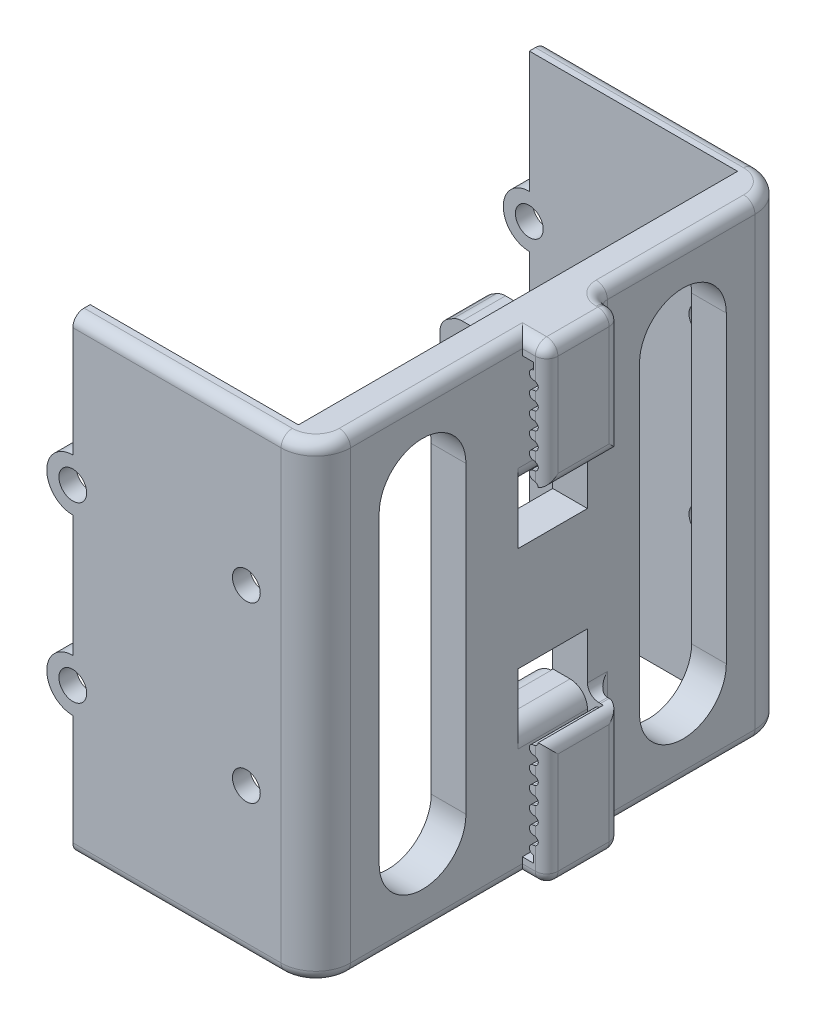
from build123d import *

# Parameters (mm, degrees)
SKETCH1_R                       = 1.6
BOSS_EXTRUDE1_DEPTH             = 2
SKETCH2_W                       = 54
SKETCH2_H                       = 54.6
SKETCH2_W_2                     = 6
SKETCH2_H_2                     = 8
BOSS_EXTRUDE2_DEPTH             = 4
BOSS_EXTRUDE6_DEPTH             = 2.5
BOSS_EXTRUDE6_DEPTH_BACK        = 2.5
BOSS_EXTRUDE7_REACH             = 45.279
BOSS_EXTRUDE7_DIRECTION_2_REACH = 45.279
FILLET3_R                       = 4
FILLET1_R                       = 2
FILLET2_R                       = 2
FILLET4_R                       = 2
BOSS_EXTRUDE8_START             = -4
BOSS_EXTRUDE8_DEPTH             = 7.5
SKETCH7_W                       = 2.8
SKETCH7_H                       = 14.3
BOSS_EXTRUDE9_DEPTH             = 1
FILLET5_R                       = 1.3
CUT_EXTRUDE1_DEPTH              = 4


with BuildPart() as part:
    # Sketch1 → Boss-Extrude1 (new body)
    with BuildSketch(Plane(origin=(0, 0, 25.3), x_dir=(0, 1, 0), z_dir=(0, 0, 1))):
        with BuildLine():
            Line((-13, 12), (-27, 12))
            Line((-27, 12), (-27, -12))
            Line((-27, -12), (27, -12))
            Line((27, -12), (27, 12))
            Line((27, 12), (13, 12))
            ThreePointArc((13, 12), (10, 15), (7, 12))
            Line((7, 12), (-7, 12))
            ThreePointArc((-7, 12), (-10, 15), (-13, 12))
        make_face()
        with Locations(Location((-10, 12, 0), (0, 0, 270))):
            Circle(SKETCH1_R, mode=Mode.SUBTRACT)
        with Locations(Location((10, 12, 0), (0, 0, 270))):
            Circle(SKETCH1_R, mode=Mode.SUBTRACT)
        with Locations(Location((10, -8, 0), (0, 0, 270))):
            Circle(SKETCH1_R, mode=Mode.SUBTRACT)
        with Locations(Location((-10, -8, 0), (0, 0, 270))):
            Circle(SKETCH1_R, mode=Mode.SUBTRACT)
    extrude(amount=BOSS_EXTRUDE1_DEPTH)


with BuildPart() as body_2:
    # Mirror3: mirrored copy
    add(part.part.mirror(Plane.XY))


with BuildPart() as part_1:
    add(part.part)

    add(body_2.part)  # Boss-Extrude2 merges body 2
    # Sketch2 → Boss-Extrude2 (add)
    with BuildSketch(Plane.YZ.offset(12)):
        Rectangle(SKETCH2_W, SKETCH2_H)
        with Locations((-9, 0)):
            Rectangle(SKETCH2_W_2, SKETCH2_H_2, mode=Mode.SUBTRACT)
        with Locations((9, 0)):
            Rectangle(SKETCH2_W_2, SKETCH2_H_2, mode=Mode.SUBTRACT)
    extrude(amount=BOSS_EXTRUDE2_DEPTH)

    # Sketch3 → Boss-Extrude6 (add, two sides: drawn at the far end of the back side and taken through both)
    with BuildSketch(Plane(origin=(0, 0, 0), x_dir=(0, 1, 0), z_dir=(0, 0, 1)).offset(-BOSS_EXTRUDE6_DEPTH_BACK)):
        Polygon((-24, -12), (-24, -7.5), (-22.8, -5.5), (-20, -5.5), (-12, -11), (-12, -12), align=None)
        Polygon((12, -12), (24, -12), (24, -7.5), (22.8, -5.5), (20, -5.5), (12, -11), align=None)
    extrude(amount=BOSS_EXTRUDE6_DEPTH + BOSS_EXTRUDE6_DEPTH_BACK)

    # Boss-Extrude7: up to this face of the body (flat: up to its plane)
    boss_extrude7_end = Plane(part_1.part.faces().sort_by_distance((14, -9, -4))[0])
    # Sketch5 → Boss-Extrude7 (add, up to the picked face)
    with BuildSketch(Plane(origin=(0, 0, -2.5), x_dir=(1, 0, 0), z_dir=(0, 0, -1)), mode=Mode.PRIVATE) as boss_extrude7_sk1:
        Polygon((12, 12), (11, 12), (10.3125, 13), (12, 13), align=None)
    boss_extrude7_tool1 = split(extrude(boss_extrude7_sk1.sketch, amount=BOSS_EXTRUDE7_REACH, mode=Mode.PRIVATE), bisect_by=boss_extrude7_end, keep=Keep.BOTH, mode=Mode.PRIVATE)
    # Sketch5 → Boss-Extrude7 (add, up to the picked face)
    with BuildSketch(Plane(origin=(0, 0, -2.5), x_dir=(1, 0, 0), z_dir=(0, 0, -1)), mode=Mode.PRIVATE) as boss_extrude7_sk2:
        Polygon((12, -13), (12, -12), (11, -12), (10.3125, -13), align=None)
    boss_extrude7_tool2 = split(extrude(boss_extrude7_sk2.sketch, amount=BOSS_EXTRUDE7_REACH, mode=Mode.PRIVATE), bisect_by=boss_extrude7_end, keep=Keep.BOTH, mode=Mode.PRIVATE)
    add(boss_extrude7_tool1.solids().sort_by(Axis((11.313469, -12.542636, -2.5), (0, 0, -1)))[0])
    add(boss_extrude7_tool2.solids().sort_by(Axis((11.313469, 12.542636, -2.5), (0, 0, -1)))[0])

    # Boss-Extrude7 direction 2: up to this face of the body (flat: up to its plane)
    boss_extrude7_direction_2_end = Plane(part_1.part.faces().sort_by_distance((14, -9, 4))[0])
    # Sketch5 → Boss-Extrude7 direction 2 (add, up to the picked face)
    with BuildSketch(Plane(origin=(0, 0, -2.5), x_dir=(1, 0, 0), z_dir=(0, 0, -1)), mode=Mode.PRIVATE) as boss_extrude7_direction_2_sk1:
        Polygon((12, 12), (11, 12), (10.3125, 13), (12, 13), align=None)
    boss_extrude7_direction_2_tool1 = split(extrude(boss_extrude7_direction_2_sk1.sketch, amount=-BOSS_EXTRUDE7_DIRECTION_2_REACH, mode=Mode.PRIVATE), bisect_by=boss_extrude7_direction_2_end, keep=Keep.BOTH, mode=Mode.PRIVATE)
    # Sketch5 → Boss-Extrude7 direction 2 (add, up to the picked face)
    with BuildSketch(Plane(origin=(0, 0, -2.5), x_dir=(1, 0, 0), z_dir=(0, 0, -1)), mode=Mode.PRIVATE) as boss_extrude7_direction_2_sk2:
        Polygon((12, -13), (12, -12), (11, -12), (10.3125, -13), align=None)
    boss_extrude7_direction_2_tool2 = split(extrude(boss_extrude7_direction_2_sk2.sketch, amount=-BOSS_EXTRUDE7_DIRECTION_2_REACH, mode=Mode.PRIVATE), bisect_by=boss_extrude7_direction_2_end, keep=Keep.BOTH, mode=Mode.PRIVATE)
    add(boss_extrude7_direction_2_tool1.solids().sort_by(Axis((11.313469, -12.542636, -2.5), (0, 0, 1)))[0])
    add(boss_extrude7_direction_2_tool2.solids().sort_by(Axis((11.313469, 12.542636, -2.5), (0, 0, 1)))[0])

    # Fillet3
    fillet3_edges = [part_1.edges().sort_by_distance(p)[0] for p in [
        (16, 0, -27.3),
        (16, 0, 27.3),
    ]]
    fillet(fillet3_edges, radius=FILLET3_R)

    # Fillet1
    fillet1_edges = [part_1.edges().sort_by_distance(p)[0] for p in [
        (7.5, -24, 0),
        (5.5, -22.8, 0),
        (5.5, -20, 0),
        (5.5, 20, 0),
        (5.5, 22.8, 0),
        (7.5, 24, 0),
    ]]
    fillet(fillet1_edges, radius=FILLET1_R)

    # Fillet2
    # the kernel refuses this fillet: 2 mm, written as the material it takes off along each edge
    with BuildSketch(Plane(origin=(11, -12, -4), x_dir=(1, 0, 0), z_dir=(0, 0, 1))) as fillet2_piece_1:
        with BuildLine():
            CenterArc((FILLET2_R * 0.526030489934, -FILLET2_R), FILLET2_R, 90, 55.491477012)
            Line((-FILLET2_R * 0.298011434265, -FILLET2_R * 0.433471177113), (0, 0))
            Line((0, 0), (FILLET2_R * 0.526030489934, 0))
        make_face()
    extrude(amount=8, mode=Mode.SUBTRACT)
    with BuildSketch(Plane(origin=(11, 12, 4), x_dir=(-0.5665288228870663, 0.8240419241993667, 0), z_dir=(0, 0, -1))) as fillet2_piece_2:
        with BuildLine():
            CenterArc((FILLET2_R * 0.526030489934, FILLET2_R), FILLET2_R, 214.508522988, 55.491477012)
            Line((-FILLET2_R * 0.298011434265, FILLET2_R * 0.433471177113), (0, 0))
            Line((0, 0), (FILLET2_R * 0.526030489934, 0))
        make_face()
    extrude(amount=8, mode=Mode.SUBTRACT)
    with BuildSketch(Plane(origin=(16, -12, -4), x_dir=(0, -1, 0), z_dir=(0, 0, 1))) as fillet2_piece_3:
        with BuildLine():
            CenterArc((FILLET2_R, -FILLET2_R), FILLET2_R, 90, 90)
            Line((0, -FILLET2_R), (0, 0))
            Line((0, 0), (FILLET2_R, 0))
        make_face()
    extrude(amount=8, mode=Mode.SUBTRACT)
    with BuildSketch(Plane(origin=(16, 12, 4), x_dir=(-1, 0, 0), z_dir=(0, 0, -1))) as fillet2_piece_4:
        with BuildLine():
            CenterArc((FILLET2_R, FILLET2_R), FILLET2_R, 180, 90)
            Line((0, FILLET2_R), (0, 0))
            Line((0, 0), (FILLET2_R, 0))
        make_face()
    extrude(amount=8, mode=Mode.SUBTRACT)

    # Fillet4
    # the kernel refuses this fillet: 2 mm, written as the material it takes off along each edge
    with BuildSketch(Plane(origin=(12, 13, 4), x_dir=(0, -1, 0), z_dir=(-1, 0, 0))) as fillet4_piece_1:
        with BuildLine():
            CenterArc((1.936491673, -2), FILLET4_R, 90, 75.522487814)
            Line((0, -1.5), (0, 0))
            Line((0, 0), (1.936491673, 0))
        make_face()
    extrude(amount=6.528729183, mode=Mode.SUBTRACT)
    with BuildSketch(Plane(origin=(12, 13, -4), x_dir=(0, 0, 1), z_dir=(-1, 0, 0))) as fillet4_piece_2:
        with BuildLine():
            CenterArc((2, -1.936491673), FILLET4_R, 104.477512186, 75.522487814)
            Line((0, -1.936491673), (0, 0))
            Line((0, 0), (1.5, 0))
        make_face()
    extrude(amount=6.528729183, mode=Mode.SUBTRACT)
    with BuildSketch(Plane(origin=(12, -13, -4), x_dir=(0, 0, 1), z_dir=(-1, 0, 0))) as fillet4_piece_3:
        with BuildLine():
            CenterArc((2, 1.936491673), FILLET4_R, 180, 75.522487814)
            Line((0, 1.936491673), (0, 0))
            Line((0, 0), (1.5, 0))
        make_face()
    extrude(amount=6.528729183, mode=Mode.SUBTRACT)
    with BuildSketch(Plane(origin=(12, -13, 4), x_dir=(0, 1, 0), z_dir=(-1, 0, 0))) as fillet4_piece_4:
        with BuildLine():
            CenterArc((1.936491673, 2), FILLET4_R, 194.477512186, 75.522487814)
            Line((0, 1.5), (0, 0))
            Line((0, 0), (1.936491673, 0))
        make_face()
    extrude(amount=6.528729183, mode=Mode.SUBTRACT)

    # Sketch6 → Boss-Extrude8 (add)
    with BuildSketch(Plane(origin=(0, 0, 0), x_dir=(0, 1, 0), z_dir=(0, 0, 1)).offset(BOSS_EXTRUDE8_START)):
        with BuildLine():
            Line((-25, -16), (-27, -16))
            Line((-27, -16), (-27, -18.8))
            Line((-27, -18.8), (-12.7, -18.8))
            Line((-12.7, -18.8), (-12.7, -17.8))
            ThreePointArc((-12.7, -17.8), (-13.053553391, -17.653553391), (-13.2, -17.3))
            ThreePointArc((-13.2, -17.3), (-13.7, -16.8), (-14.2, -17.3))
            ThreePointArc((-14.2, -17.3), (-14.7, -17.8), (-15.2, -17.3))
            ThreePointArc((-15.2, -17.3), (-15.7, -16.8), (-16.2, -17.3))
            ThreePointArc((-16.2, -17.3), (-16.7, -17.8), (-17.2, -17.3))
            ThreePointArc((-17.2, -17.3), (-17.7, -16.8), (-18.2, -17.3))
            ThreePointArc((-18.2, -17.3), (-18.7, -17.8), (-19.2, -17.3))
            ThreePointArc((-19.2, -17.3), (-19.7, -16.8), (-20.2, -17.3))
            ThreePointArc((-20.2, -17.3), (-20.7, -17.8), (-21.2, -17.3))
            ThreePointArc((-21.2, -17.3), (-21.7, -16.8), (-22.2, -17.3))
            ThreePointArc((-22.2, -17.3), (-22.7, -17.8), (-23.2, -17.3))
            ThreePointArc((-23.2, -17.3), (-23.7, -16.8), (-24.2, -17.3))
            Line((-24.2, -17.3), (-25, -17.3))
            Line((-25, -17.3), (-25, -16))
        make_face()
    boss_extrude8 = extrude(amount=BOSS_EXTRUDE8_DEPTH)

    # Sketch7 → Boss-Extrude9 (add)
    with BuildSketch(Plane(origin=(0, 0, -4), x_dir=(1, 0, 0), z_dir=(0, 0, -1))):
        with Locations((17.4, 19.85)):
            Rectangle(SKETCH7_W, SKETCH7_H)
    boss_extrude9 = extrude(amount=BOSS_EXTRUDE9_DEPTH)

    # Mirror4: Boss-Extrude8, Boss-Extrude9 across plane
    add(boss_extrude8.mirror(Plane.ZX))
    add(boss_extrude9.mirror(Plane.ZX))

    # Fillet5
    # the kernel refuses this fillet: 1.3 mm, written as the material it adds along each edge
    with BuildSketch(Plane(origin=(16, -12.7, -4), x_dir=(0, 1, 0), z_dir=(0, 0, -1))) as fillet5_piece_1:
        with BuildLine():
            CenterArc((FILLET5_R, FILLET5_R), FILLET5_R, 180, 90)
            Line((0, FILLET5_R), (0, 0))
            Line((0, 0), (FILLET5_R, 0))
        make_face()
    extrude(amount=1)
    with BuildSketch(Plane(origin=(16, -27, -5), x_dir=(0, 0, -1), z_dir=(0, 1, 0))) as fillet5_piece_2:
        with BuildLine():
            CenterArc((FILLET5_R, -FILLET5_R), FILLET5_R, 90, 90)
            Line((0, -FILLET5_R), (0, 0))
            Line((0, 0), (FILLET5_R, 0))
        make_face()
    extrude(amount=14.3)
    with BuildSketch(Plane(origin=(16, 27, -5), x_dir=(0, 0, -1), z_dir=(0, -1, 0))) as fillet5_piece_3:
        with BuildLine():
            CenterArc((FILLET5_R, FILLET5_R), FILLET5_R, 180, 90)
            Line((0, FILLET5_R), (0, 0))
            Line((0, 0), (FILLET5_R, 0))
        make_face()
    extrude(amount=14.3)
    with BuildSketch(Plane(origin=(16, 12.7, -4), x_dir=(0, -1, 0), z_dir=(0, 0, -1))) as fillet5_piece_4:
        with BuildLine():
            CenterArc((FILLET5_R, -FILLET5_R), FILLET5_R, 90, 90)
            Line((0, -FILLET5_R), (0, 0))
            Line((0, 0), (FILLET5_R, 0))
        make_face()
    extrude(amount=1)
    with BuildSketch(Plane(origin=(16, -12.7, -4), x_dir=(0, 1, 0), z_dir=(0, 0, -1))) as fillet5_piece_5a_section:
        with BuildLine():
            CenterArc((FILLET5_R, FILLET5_R), FILLET5_R, 180, 90)
            Line((0, FILLET5_R), (0, 0))
            Line((0, 0), (FILLET5_R, 0))
        make_face()
    fillet5_piece_5a = extrude(amount=4.25, mode=Mode.PRIVATE)
    fillet5_piece_5a = split(fillet5_piece_5a, bisect_by=Plane(origin=(16, -12.7, -5), z_dir=(0, 0, -1)), keep=Keep.TOP, mode=Mode.PRIVATE)
    with BuildSketch(Plane(origin=(16, -27, -5), x_dir=(0, 0, -1), z_dir=(0, 1, 0))) as fillet5_piece_5b_section:
        with BuildLine():
            CenterArc((FILLET5_R, -FILLET5_R), FILLET5_R, 90, 90)
            Line((0, -FILLET5_R), (0, 0))
            Line((0, 0), (FILLET5_R, 0))
        make_face()
    fillet5_piece_5b = extrude(amount=17.55, mode=Mode.PRIVATE)
    fillet5_piece_5b = split(fillet5_piece_5b, bisect_by=Plane(origin=(16, -12.7, -5), z_dir=(0, 1, 0)), keep=Keep.TOP, mode=Mode.PRIVATE)
    fillet5_piece_5 = fillet5_piece_5a & fillet5_piece_5b
    add(fillet5_piece_5)
    with BuildSketch(Plane(origin=(16, 27, -5), x_dir=(0, 0, -1), z_dir=(0, -1, 0))) as fillet5_piece_6a_section:
        with BuildLine():
            CenterArc((FILLET5_R, FILLET5_R), FILLET5_R, 180, 90)
            Line((0, FILLET5_R), (0, 0))
            Line((0, 0), (FILLET5_R, 0))
        make_face()
    fillet5_piece_6a = extrude(amount=17.55, mode=Mode.PRIVATE)
    fillet5_piece_6a = split(fillet5_piece_6a, bisect_by=Plane(origin=(16, 12.7, -5), z_dir=(0, -1, 0)), keep=Keep.TOP, mode=Mode.PRIVATE)
    with BuildSketch(Plane(origin=(16, 12.7, -4), x_dir=(0, -1, 0), z_dir=(0, 0, -1))) as fillet5_piece_6b_section:
        with BuildLine():
            CenterArc((FILLET5_R, -FILLET5_R), FILLET5_R, 90, 90)
            Line((0, -FILLET5_R), (0, 0))
            Line((0, 0), (FILLET5_R, 0))
        make_face()
    fillet5_piece_6b = extrude(amount=4.25, mode=Mode.PRIVATE)
    fillet5_piece_6b = split(fillet5_piece_6b, bisect_by=Plane(origin=(16, 12.7, -5), z_dir=(0, 0, -1)), keep=Keep.TOP, mode=Mode.PRIVATE)
    fillet5_piece_6 = fillet5_piece_6a & fillet5_piece_6b
    add(fillet5_piece_6)
    # the kernel refuses this fillet: 1.3 mm, written as the material it takes off along each edge
    with BuildSketch(Plane(origin=(17.5, -25.7, 2.2), x_dir=(0, 0, 1), z_dir=(0, -1, 0))) as fillet5_2_piece_1_section:
        Polygon((0, 0), (FILLET5_R, 0), (FILLET5_R, -FILLET5_R), (0, -FILLET5_R), align=None)
    fillet5_2_piece_1 = extrude(amount=FILLET5_R, mode=Mode.PRIVATE)
    fillet5_2_piece_1 = fillet5_2_piece_1 - Plane(origin=(17.5, -25.7, 2.2), x_dir=(-0.7071067811865475, 0, -0.7071067811865475), z_dir=(0, -1, 0)) * Sphere(FILLET5_R, mode=Mode.PRIVATE)
    add(fillet5_2_piece_1, mode=Mode.SUBTRACT)
    with BuildSketch(Plane(origin=(17.5, 25.7, 2.2), x_dir=(0, 1, 0), z_dir=(0, 0, 1))) as fillet5_2_piece_2_section:
        Polygon((0, 0), (FILLET5_R, 0), (FILLET5_R, -FILLET5_R), (0, -FILLET5_R), align=None)
    fillet5_2_piece_2 = extrude(amount=FILLET5_R, mode=Mode.PRIVATE)
    fillet5_2_piece_2 = fillet5_2_piece_2 - Plane(origin=(17.5, 25.7, 2.2), x_dir=(-0.7071067811865477, -0.7071067811865475, 0), z_dir=(0, 0, 1)) * Sphere(FILLET5_R, mode=Mode.PRIVATE)
    add(fillet5_2_piece_2, mode=Mode.SUBTRACT)
    with BuildSketch(Plane(origin=(12, -27, 27.3), x_dir=(0, 1, 0), z_dir=(-1, 0, 0)), Plane(origin=(12, 27, 27.3), x_dir=(0, 0, -1), z_dir=(-1, 0, 0))) as fillet5_2_piece_3:
        with BuildLine():
            CenterArc((FILLET5_R, FILLET5_R), FILLET5_R, 180, 90)
            Line((0, FILLET5_R), (0, 0))
            Line((0, 0), (FILLET5_R, 0))
        make_face()
    extrude(amount=27.25, mode=Mode.SUBTRACT)
    with BuildSketch(Plane(origin=(16, -27, 3.5), x_dir=(0, 1, 0), z_dir=(0, 0, 1)), Plane(origin=(16, 27, 23.3), x_dir=(0, -1, 0), z_dir=(0, 0, -1))) as fillet5_2_piece_4:
        with BuildLine():
            CenterArc((FILLET5_R, FILLET5_R), FILLET5_R, 180, 90)
            Line((0, FILLET5_R), (0, 0))
            Line((0, 0), (FILLET5_R, 0))
        make_face()
    extrude(amount=19.8, mode=Mode.SUBTRACT)
    with BuildSketch(Plane(origin=(12, -27, 23.3), x_dir=(0, 0, 1), z_dir=(-1, 0, 0))) as fillet5_2_piece_5:
        with BuildLine():
            CenterArc((4 - FILLET5_R, FILLET5_R), FILLET5_R, 270, 90)
            Line((4 - FILLET5_R, 0), (4, 0))
            Line((4, 0), (4, FILLET5_R))
        make_face()
    revolve(axis=Axis((12, -27, 23.3), (0, 1, 0)), revolution_arc=90, mode=Mode.SUBTRACT)
    with BuildSketch(Plane(origin=(12, 27, 23.3), x_dir=(0, 0, 1), z_dir=(-1, 0, 0))) as fillet5_2_piece_6:
        with BuildLine():
            CenterArc((4 - FILLET5_R, -FILLET5_R), FILLET5_R, 0, 90)
            Line((4, -FILLET5_R), (4, 0))
            Line((4, 0), (4 - FILLET5_R, 0))
        make_face()
    revolve(axis=Axis((12, 27, 23.3), (0, 1, 0)), revolution_arc=90, mode=Mode.SUBTRACT)
    with BuildSketch(Plane(origin=(18.8, -12.7, -8.25), x_dir=(-1, 0, 0), z_dir=(0, 0, 1)), Plane(origin=(18.8, 12.7, 6.75), x_dir=(-1, 0, 0), z_dir=(0, 0, -1))) as fillet5_2_piece_7:
        with BuildLine():
            CenterArc((FILLET5_R, FILLET5_R), FILLET5_R, 180, 90)
            Line((0, FILLET5_R), (0, 0))
            Line((0, 0), (FILLET5_R, 0))
        make_face()
    extrude(amount=15, mode=Mode.SUBTRACT)
    with BuildSketch(Plane(origin=(18.8, -27, -8.25), x_dir=(0, 1, 0), z_dir=(0, 0, 1)), Plane(origin=(18.8, 27, 2.2), x_dir=(0, -1, 0), z_dir=(0, 0, -1))) as fillet5_2_piece_8:
        with BuildLine():
            CenterArc((FILLET5_R, FILLET5_R), FILLET5_R, 180, 90)
            Line((0, FILLET5_R), (0, 0))
            Line((0, 0), (FILLET5_R, 0))
        make_face()
    extrude(amount=10.45, mode=Mode.SUBTRACT)
    with BuildSketch(Plane(origin=(16, -27, 3.5), x_dir=(0, 0, -1), z_dir=(1, 0, 0)), Plane(origin=(16, 27, 3.5), x_dir=(0, -1, 0), z_dir=(1, 0, 0))) as fillet5_2_piece_9:
        with BuildLine():
            CenterArc((FILLET5_R, FILLET5_R), FILLET5_R, 180, 90)
            Line((0, FILLET5_R), (0, 0))
            Line((0, 0), (FILLET5_R, 0))
        make_face()
    extrude(amount=1.5, mode=Mode.SUBTRACT)
    with BuildSketch(Plane(origin=(18.8, -25.7, 3.5), x_dir=(0, 0, -1), z_dir=(0, 1, 0))) as fillet5_2_piece_10:
        with BuildLine():
            CenterArc((FILLET5_R, FILLET5_R), FILLET5_R, 180, 90)
            Line((0, FILLET5_R), (0, 0))
            Line((0, 0), (FILLET5_R, 0))
        make_face()
    extrude(amount=16.25, mode=Mode.SUBTRACT)
    with BuildSketch(Plane(origin=(18.8, -9.45, -5), x_dir=(-1, 0, 0), z_dir=(0, -1, 0))) as fillet5_2_piece_11:
        with BuildLine():
            CenterArc((FILLET5_R, -FILLET5_R), FILLET5_R, 90, 90)
            Line((0, -FILLET5_R), (0, 0))
            Line((0, 0), (FILLET5_R, 0))
        make_face()
    extrude(amount=20.8, mode=Mode.SUBTRACT)
    with BuildSketch(Plane(origin=(18.8, 25.7, 3.5), x_dir=(0, 0, -1), z_dir=(0, -1, 0))) as fillet5_2_piece_12:
        with BuildLine():
            CenterArc((FILLET5_R, -FILLET5_R), FILLET5_R, 90, 90)
            Line((0, -FILLET5_R), (0, 0))
            Line((0, 0), (FILLET5_R, 0))
        make_face()
    extrude(amount=16.25, mode=Mode.SUBTRACT)
    with BuildSketch(Plane(origin=(18.8, 9.45, -5), x_dir=(-1, 0, 0), z_dir=(0, 1, 0))) as fillet5_2_piece_13:
        with BuildLine():
            CenterArc((FILLET5_R, FILLET5_R), FILLET5_R, 180, 90)
            Line((0, FILLET5_R), (0, 0))
            Line((0, 0), (FILLET5_R, 0))
        make_face()
    extrude(amount=20.8, mode=Mode.SUBTRACT)
    with BuildSketch(Plane(origin=(16, -27, 0.25), x_dir=(0, 1, 0), z_dir=(0, 0, 1))) as fillet5_2_piece_14a_section:
        with BuildLine():
            CenterArc((FILLET5_R, FILLET5_R), FILLET5_R, 180, 90)
            Line((0, FILLET5_R), (0, 0))
            Line((0, 0), (FILLET5_R, 0))
        make_face()
    fillet5_2_piece_14a = extrude(amount=23.05, mode=Mode.PRIVATE)
    fillet5_2_piece_14a = split(fillet5_2_piece_14a, bisect_by=Plane(origin=(16, -27, 3.5), z_dir=(0, 0, -1)), keep=Keep.TOP, mode=Mode.PRIVATE)
    with BuildSketch(Plane(origin=(12.75, -27, 3.5), x_dir=(0, 0, -1), z_dir=(1, 0, 0))) as fillet5_2_piece_14b_section:
        with BuildLine():
            CenterArc((FILLET5_R, FILLET5_R), FILLET5_R, 180, 90)
            Line((0, FILLET5_R), (0, 0))
            Line((0, 0), (FILLET5_R, 0))
        make_face()
    fillet5_2_piece_14b = extrude(amount=4.75, mode=Mode.PRIVATE)
    fillet5_2_piece_14b = split(fillet5_2_piece_14b, bisect_by=Plane(origin=(16, -27, 3.5), z_dir=(-1, 0, 0)), keep=Keep.TOP, mode=Mode.PRIVATE)
    fillet5_2_piece_14 = fillet5_2_piece_14a & fillet5_2_piece_14b
    add(fillet5_2_piece_14, mode=Mode.SUBTRACT)
    with BuildSketch(Plane(origin=(16, 27, 23.3), x_dir=(0, -1, 0), z_dir=(0, 0, -1))) as fillet5_2_piece_15a_section:
        with BuildLine():
            CenterArc((FILLET5_R, FILLET5_R), FILLET5_R, 180, 90)
            Line((0, FILLET5_R), (0, 0))
            Line((0, 0), (FILLET5_R, 0))
        make_face()
    fillet5_2_piece_15a = extrude(amount=23.05, mode=Mode.PRIVATE)
    fillet5_2_piece_15a = split(fillet5_2_piece_15a, bisect_by=Plane(origin=(16, 27, 3.5), z_dir=(0, 0, -1)), keep=Keep.TOP, mode=Mode.PRIVATE)
    with BuildSketch(Plane(origin=(12.75, 27, 3.5), x_dir=(0, -1, 0), z_dir=(1, 0, 0))) as fillet5_2_piece_15b_section:
        with BuildLine():
            CenterArc((FILLET5_R, FILLET5_R), FILLET5_R, 180, 90)
            Line((0, FILLET5_R), (0, 0))
            Line((0, 0), (FILLET5_R, 0))
        make_face()
    fillet5_2_piece_15b = extrude(amount=4.75, mode=Mode.PRIVATE)
    fillet5_2_piece_15b = split(fillet5_2_piece_15b, bisect_by=Plane(origin=(16, 27, 3.5), z_dir=(-1, 0, 0)), keep=Keep.TOP, mode=Mode.PRIVATE)
    fillet5_2_piece_15 = fillet5_2_piece_15a & fillet5_2_piece_15b
    add(fillet5_2_piece_15, mode=Mode.SUBTRACT)
    # the kernel refuses this fillet: 1.3 mm, written as the material it takes off along each edge
    with BuildSketch(Plane(origin=(17.5, 25.7, -3.7), x_dir=(0, 1, 0), z_dir=(0, 0, -1))) as fillet5_3_piece_1_section:
        Polygon((0, 0), (FILLET5_R, 0), (FILLET5_R, FILLET5_R), (0, FILLET5_R), align=None)
    fillet5_3_piece_1 = extrude(amount=FILLET5_R, mode=Mode.PRIVATE)
    fillet5_3_piece_1 = fillet5_3_piece_1 - Plane(origin=(17.5, 25.7, -3.7), x_dir=(-0.7071067811865477, -0.7071067811865475, 0), z_dir=(0, 0, -1)) * Sphere(FILLET5_R, mode=Mode.PRIVATE)
    add(fillet5_3_piece_1, mode=Mode.SUBTRACT)
    with BuildSketch(Plane(origin=(17.5, -25.7, -3.7), x_dir=(0, -1, 0), z_dir=(0, 0, -1))) as fillet5_3_piece_2_section:
        Polygon((0, 0), (FILLET5_R, 0), (FILLET5_R, -FILLET5_R), (0, -FILLET5_R), align=None)
    fillet5_3_piece_2 = extrude(amount=FILLET5_R, mode=Mode.PRIVATE)
    fillet5_3_piece_2 = fillet5_3_piece_2 - Plane(origin=(17.5, -25.7, -3.7), x_dir=(-0.7071067811865477, 0.7071067811865475, 0), z_dir=(0, 0, -1)) * Sphere(FILLET5_R, mode=Mode.PRIVATE)
    add(fillet5_3_piece_2, mode=Mode.SUBTRACT)
    with BuildSketch(Plane(origin=(16, 27, -6.3), x_dir=(0, -1, 0), z_dir=(0, 0, -1)), Plane(origin=(16, -27, -23.3), x_dir=(0, 1, 0), z_dir=(0, 0, 1))) as fillet5_3_piece_3:
        with BuildLine():
            CenterArc((FILLET5_R, FILLET5_R), FILLET5_R, 180, 90)
            Line((0, FILLET5_R), (0, 0))
            Line((0, 0), (FILLET5_R, 0))
        make_face()
    extrude(amount=17, mode=Mode.SUBTRACT)
    with BuildSketch(Plane(origin=(-15.25, -27, -27.3), x_dir=(0, 1, 0), z_dir=(1, 0, 0)), Plane(origin=(-15.25, 27, -27.3), x_dir=(0, 0, 1), z_dir=(1, 0, 0))) as fillet5_3_piece_4:
        with BuildLine():
            CenterArc((FILLET5_R, FILLET5_R), FILLET5_R, 180, 90)
            Line((0, FILLET5_R), (0, 0))
            Line((0, 0), (FILLET5_R, 0))
        make_face()
    extrude(amount=27.25, mode=Mode.SUBTRACT)
    with BuildSketch(Plane(origin=(12, -27, -23.3), x_dir=(0, 0, -1), z_dir=(-1, 0, 0))) as fillet5_3_piece_5:
        with BuildLine():
            CenterArc((4 - FILLET5_R, -FILLET5_R), FILLET5_R, 0, 90)
            Line((4 - FILLET5_R, 0), (4, 0))
            Line((4, 0), (4, -FILLET5_R))
        make_face()
    revolve(axis=Axis((12, -27, -23.3), (0, -1, 0)), revolution_arc=90, mode=Mode.SUBTRACT)
    with BuildSketch(Plane(origin=(12, 27, -23.3), x_dir=(0, 0, -1), z_dir=(-1, 0, 0))) as fillet5_3_piece_6:
        with BuildLine():
            CenterArc((4 - FILLET5_R, FILLET5_R), FILLET5_R, 270, 90)
            Line((4, FILLET5_R), (4, 0))
            Line((4, 0), (4 - FILLET5_R, 0))
        make_face()
    revolve(axis=Axis((12, 27, -23.3), (0, -1, 0)), revolution_arc=90, mode=Mode.SUBTRACT)
    with BuildSketch(Plane(origin=(17.5, -27, -5), x_dir=(0, 1, 0), z_dir=(-1, 0, 0))) as fillet5_3_piece_7:
        with BuildLine():
            CenterArc((FILLET5_R, -FILLET5_R), FILLET5_R, 90, 90)
            Line((0, -FILLET5_R), (0, 0))
            Line((0, 0), (FILLET5_R, 0))
        make_face()
    extrude(amount=0.2, mode=Mode.SUBTRACT)
    with BuildSketch(Plane(origin=(17.5, 27, -5), x_dir=(0, -1, 0), z_dir=(-1, 0, 0))) as fillet5_3_piece_8:
        with BuildLine():
            CenterArc((FILLET5_R, FILLET5_R), FILLET5_R, 180, 90)
            Line((0, FILLET5_R), (0, 0))
            Line((0, 0), (FILLET5_R, 0))
        make_face()
    extrude(amount=0.2, mode=Mode.SUBTRACT)
    with BuildSketch(Plane(origin=(17.3, 27, -6.3), x_dir=(-1, 0, 0), z_dir=(0, 0, -1))) as fillet5_3_piece_9:
        with BuildLine():
            CenterArc((1.3 + FILLET5_R, -FILLET5_R), FILLET5_R, 90, 90)
            Line((1.3 + FILLET5_R, 0), (1.3, 0))
            Line((1.3, 0), (1.3, -FILLET5_R))
        make_face()
    revolve(axis=Axis((17.3, 27, -6.3), (0, 1, 0)), revolution_arc=90, mode=Mode.SUBTRACT)
    with BuildSketch(Plane(origin=(17.3, -27, -6.3), x_dir=(-1, 0, 0), z_dir=(0, 0, -1))) as fillet5_3_piece_10:
        with BuildLine():
            CenterArc((1.3 + FILLET5_R, FILLET5_R), FILLET5_R, 180, 90)
            Line((1.3, FILLET5_R), (1.3, 0))
            Line((1.3, 0), (1.3 + FILLET5_R, 0))
        make_face()
    revolve(axis=Axis((17.3, -27, -6.3), (0, 1, 0)), revolution_arc=90, mode=Mode.SUBTRACT)

    # Sketch8 → Cut-Extrude1 (cut)
    with BuildSketch(Plane.YZ.offset(16)):
        with BuildLine():
            Line((-17.5, 20), (17.5, 20))
            ThreePointArc((17.5, 20), (22.5, 15), (17.5, 10))
            Line((17.5, 10), (-17.5, 10))
            ThreePointArc((-17.5, 10), (-22.5, 15), (-17.5, 20))
        make_face()
        with BuildLine():
            Line((-17.5, -20), (17.5, -20))
            ThreePointArc((17.5, -20), (22.5, -15), (17.5, -10))
            Line((17.5, -10), (-17.5, -10))
            ThreePointArc((-17.5, -10), (-22.5, -15), (-17.5, -20))
        make_face()
    extrude(amount=-CUT_EXTRUDE1_DEPTH, mode=Mode.SUBTRACT)


solid = part_1.part
